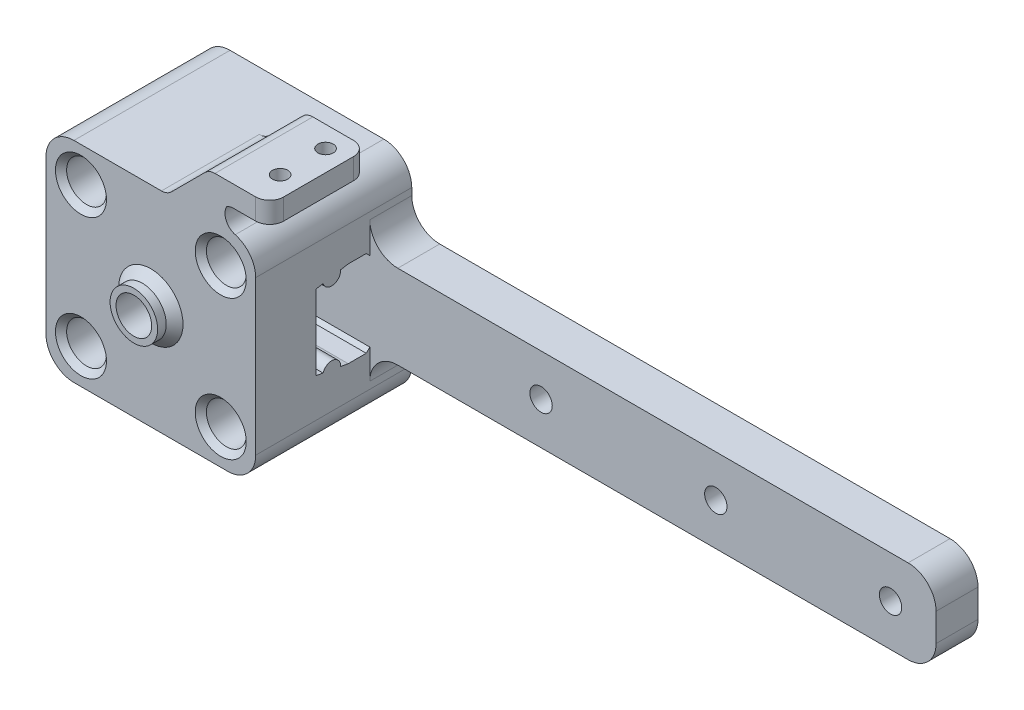
from build123d import *

# Parameters (mm, degrees)
SKETCH1_W           = 30
SKETCH1_H           = 30
SKETCH1_R           = 1.6
SKETCH1_W_2         = 81.01
SKETCH1_H_2         = 12
BOSS_EXTRUDE1_DEPTH = 6
SKETCH1_3_W         = 30
SKETCH1_3_H         = 30
SKETCH1_3_R         = 1.6
BOSS_EXTRUDE2_DEPTH = 22.33
CUT_EXTRUDE1_DEPTH  = 88.671255266
SKETCH3_R           = 2.55
CUT_EXTRUDE2_DEPTH  = 8
CUT_EXTRUDE3_DEPTH  = 4.5
SKETCH6_R           = 5
CUT_EXTRUDE5_DEPTH  = 8.6
SKETCH7_R           = 1.6
CUT_EXTRUDE6_DEPTH  = 112.183402538
SKETCH8_R           = 2.85
CUT_EXTRUDE7_DEPTH  = 18
BOSS_EXTRUDE3_START = 2.43
SKETCH9_R           = 3.4
SKETCH9_R_2         = 2.55
BOSS_EXTRUDE3_DEPTH = 2.43
CHAMFER1_SIZE       = 1.2
FILLET3_R           = 4
CHAMFER2_SIZE       = 0.8
SKETCH10_R          = 2.5
CUT_EXTRUDE8_DEPTH  = 3
CHAMFER3_SIZE       = 0.8
BOSS_EXTRUDE6_DEPTH = 14
CUT_EXTRUDE10_REACH = 116.661
SKETCH17_R          = 1.1
FILLET5_R           = 2


with BuildPart() as part:
    # Sketch1 → Boss-Extrude1 (new body)
    # profile 1 of 2: a face of its own
    with BuildSketch(Plane.XY):
        with Locations((10, 10)):
            Rectangle(SKETCH1_W, SKETCH1_H)
        with Locations((20, 0)):
            Circle(SKETCH1_R, mode=Mode.SUBTRACT)
        with Locations((20, 20)):
            Circle(SKETCH1_R, mode=Mode.SUBTRACT)
        with Locations((0, 20)):
            Circle(SKETCH1_R, mode=Mode.SUBTRACT)
        Circle(SKETCH1_R, mode=Mode.SUBTRACT)
    # profile 2 of 2: a face of its own
    with BuildSketch(Plane.XY):
        with Locations((65.505, 10)):
            Rectangle(SKETCH1_W_2, SKETCH1_H_2)
    extrude(amount=BOSS_EXTRUDE1_DEPTH)

    # Sketch1<3> → Boss-Extrude2 (add)
    with BuildSketch(Plane.XY):
        with Locations((10, 10)):
            Rectangle(SKETCH1_3_W, SKETCH1_3_H)
        with Locations((20, 0)):
            Circle(SKETCH1_3_R, mode=Mode.SUBTRACT)
        with Locations((20, 20)):
            Circle(SKETCH1_3_R, mode=Mode.SUBTRACT)
        with Locations((0, 20)):
            Circle(SKETCH1_3_R, mode=Mode.SUBTRACT)
        Circle(SKETCH1_3_R, mode=Mode.SUBTRACT)
    extrude(amount=BOSS_EXTRUDE2_DEPTH)

    # Sketch2 → Cut-Extrude1 (cut, through all)
    with BuildSketch(Plane(origin=(25, 0, 0), x_dir=(0, 0, -1), z_dir=(1, 0, 0))):
        with BuildLine():
            Line((-6.515, 16.079632043), (-9.09, 16.079632043))
            Line((-9.09, 16.079632043), (-10.173218492, 15.888631397))
            ThreePointArc((-10.173218492, 15.888631397), (-11.235427971, 14.554192061), (-12.689983513, 15.444857819))
            Line((-12.689983513, 15.444857819), (-13.725, 15.262356487))
            Line((-13.725, 15.262356487), (-13.725, 4.536907598))
            Line((-13.725, 4.536907598), (-12.689983513, 4.354406266))
            ThreePointArc((-12.689983513, 4.354406266), (-11.235427971, 5.245072025), (-10.173218492, 3.910632689))
            Line((-10.173218492, 3.910632689), (-9.09, 3.719632043))
            Line((-9.09, 3.719632043), (-6.515, 3.719632043))
            Line((-6.515, 3.719632043), (-6, 4.234632043))
            Line((-6, 4.234632043), (-6, 15.564632043))
            Line((-6, 15.564632043), (-6.515, 16.079632043))
        make_face()
    extrude(amount=-CUT_EXTRUDE1_DEPTH, mode=Mode.SUBTRACT)

    # Sketch3 → Cut-Extrude2 (cut)
    with BuildSketch(Plane.XY.offset(22.33)):
        with Locations((10, 10)):
            Circle(SKETCH3_R)
    extrude(amount=-CUT_EXTRUDE2_DEPTH, mode=Mode.SUBTRACT)

    # Sketch5 → Cut-Extrude3 (cut)
    with BuildSketch(Plane(origin=(0, 0, 13.725), x_dir=(-1, 0, 0), z_dir=(0, 0, -1))):
        Polygon((-5.32346282, 10), (-7.66173141, 14.05), (-12.33826859, 14.05), (-14.67653718, 10), (-12.33826859, 5.95), (-7.66173141, 5.95), align=None)
    extrude(amount=-CUT_EXTRUDE3_DEPTH, mode=Mode.SUBTRACT)

    # Sketch6 → Cut-Extrude5 (cut)
    with BuildSketch(Plane(origin=(0, 0, 0), x_dir=(-1, 0, 0), z_dir=(0, 0, -1))):
        with Locations((-10, 10)):
            Circle(SKETCH6_R)
    extrude(amount=-CUT_EXTRUDE5_DEPTH, mode=Mode.SUBTRACT)

    # Sketch7 → Cut-Extrude6 (cut, through all)
    with BuildSketch(Plane(origin=(0, 0, 0), x_dir=(-1, 0, 0), z_dir=(0, 0, -1))):
        with BuildLine():
            ThreePointArc((-101.1, 10), (-99.5, 8.4), (-97.9, 10))
            Line((-97.9, 10), (-101.1, 10))
        make_face()
        with BuildLine():
            Line((-101.1, 10), (-97.9, 10))
            ThreePointArc((-97.9, 10), (-99.5, 11.6), (-101.1, 10))
        make_face()
        with Locations((-74.5, 10)):
            Circle(SKETCH7_R)
        with Locations((-49.5, 10)):
            Circle(SKETCH7_R)
    extrude(amount=-CUT_EXTRUDE6_DEPTH, mode=Mode.SUBTRACT)

    # Sketch8 → Cut-Extrude7 (cut)
    with BuildSketch(Plane.XY.offset(22.33)):
        with Locations((20, 20)):
            Circle(SKETCH8_R)
        with Locations((20, 0)):
            Circle(SKETCH8_R)
        Circle(SKETCH8_R)
        with Locations((0, 20)):
            Circle(SKETCH8_R)
    extrude(amount=-CUT_EXTRUDE7_DEPTH, mode=Mode.SUBTRACT)

    # Sketch9 → Boss-Extrude3 (add)
    with BuildSketch(Plane.XY.offset(22.33).offset(BOSS_EXTRUDE3_START)):
        with Locations(Location((10, 10, 0), (0, 0, 180))):
            Circle(SKETCH9_R)
        with Locations((10, 10)):
            Circle(SKETCH9_R_2, mode=Mode.SUBTRACT)
    extrude(amount=-BOSS_EXTRUDE3_DEPTH)

    # Chamfer1
    chamfer1_edges = [part.edges().sort_by_distance(p)[0] for p in [
        (13.4, 10, 22.33),
    ]]
    chamfer(chamfer1_edges, length=CHAMFER1_SIZE)

    # Fillet3
    fillet3_edges = [part.edges().sort_by_distance(p)[0] for p in [
        (-5, -5, 11.165),
        (-5, 25, 11.165),
        (25, 25, 11.165),
        (25, 16, 3),
        (106.01, 16, 3),
        (106.01, 4, 3),
        (25, 4, 3),
        (25, -5, 11.165),
    ]]
    fillet(fillet3_edges, radius=FILLET3_R)

    # Chamfer2
    chamfer2_edges = [part.edges().sort_by_distance(p)[0] for p in [
        (-2.85, 20, 22.33),
        (-2.85, 0, 22.33),
        (17.15, 0, 22.33),
        (17.15, 20, 22.33),
    ]]
    chamfer(chamfer2_edges, length=CHAMFER2_SIZE)

    # Sketch10 → Cut-Extrude8 (cut)
    with BuildSketch(Plane(origin=(0, 0, 0), x_dir=(-1, 0, 0), z_dir=(0, 0, -1))):
        with Locations((-99.5, 10)):
            Circle(SKETCH10_R)
        with Locations((-74.5, 10)):
            Circle(SKETCH10_R)
        with Locations((-49.5, 10)):
            Circle(SKETCH10_R)
    extrude(amount=-CUT_EXTRUDE8_DEPTH, mode=Mode.SUBTRACT)

    # Chamfer3
    chamfer3_edges = [part.edges().sort_by_distance(p)[0] for p in [
        (102, 10, 0),
        (77, 10, 0),
        (52, 10, 0),
    ]]
    chamfer(chamfer3_edges, length=CHAMFER3_SIZE)

    # Sketch15 → Boss-Extrude6 (add)
    with BuildSketch(Plane.XY.offset(22.33)):
        Polygon((18.343145751, 31), (12.343145751, 25), (18, 25), (21, 28), (27, 28), (27, 31), align=None)
    extrude(amount=-BOSS_EXTRUDE6_DEPTH)

    # Sketch17 → Cut-Extrude10 (cut, up to next)
    with BuildSketch(Plane(origin=(0, 31, 0), x_dir=(1, 0, 0), z_dir=(0, 1, 0)), mode=Mode.PRIVATE) as cut_extrude10_sk1:
        with Locations(Location((24, -11.33, 0), (0, 0, 180))):
            Circle(SKETCH17_R)
    cut_extrude10_tool1 = extrude(cut_extrude10_sk1.sketch, amount=-CUT_EXTRUDE10_REACH, mode=Mode.PRIVATE) & part.part
    # Sketch17 → Cut-Extrude10 (cut, up to next)
    with BuildSketch(Plane(origin=(0, 31, 0), x_dir=(1, 0, 0), z_dir=(0, 1, 0)), mode=Mode.PRIVATE) as cut_extrude10_sk2:
        with Locations(Location((24, -17.83, 0), (0, 0, 180))):
            Circle(SKETCH17_R)
    cut_extrude10_tool2 = extrude(cut_extrude10_sk2.sketch, amount=-CUT_EXTRUDE10_REACH, mode=Mode.PRIVATE) & part.part
    add(cut_extrude10_tool1.solids().sort_by_distance((24, 31, 11.33))[0], mode=Mode.SUBTRACT)
    add(cut_extrude10_tool2.solids().sort_by_distance((24, 31, 17.83))[0], mode=Mode.SUBTRACT)

    # Fillet5
    # the kernel refuses this fillet: 2 mm, written as the material it adds along each edge
    with BuildSketch(Plane(origin=(21, 28, 22.33), x_dir=(-0.7071067811865475, -0.7071067811865475, 0), z_dir=(0, 0, -1))) as fillet5_piece_1:
        with BuildLine():
            CenterArc((FILLET5_R * 0.414213562373, -FILLET5_R), FILLET5_R, 90, 45)
            Line((-FILLET5_R * 0.292893218813, -FILLET5_R * 0.292893218813), (0, 0))
            Line((0, 0), (FILLET5_R * 0.414213562373, 0))
        make_face()
    extrude(amount=14)
    with BuildSketch(Plane(origin=(12.343145751, 25, 22.33), x_dir=(-1, 0, 0), z_dir=(0, 0, -1))) as fillet5_piece_2:
        with BuildLine():
            CenterArc((FILLET5_R * 0.414213562373, FILLET5_R), FILLET5_R, 225, 45)
            Line((-FILLET5_R * 0.292893218813, FILLET5_R * 0.292893218813), (0, 0))
            Line((0, 0), (FILLET5_R * 0.414213562373, 0))
        make_face()
    extrude(amount=14)
    with BuildSketch(Plane(origin=(18, 25, 22.33), x_dir=(0.9993539414176275, -0.03594022500003582, 0), z_dir=(0, 0, -1))) as fillet5_piece_3:
        with BuildLine():
            CenterArc((4.541773641, -1.944797545), FILLET5_R, 103.492916805, 119.447416414)
            Line((3.07764659, -3.307270289), (2.931233885, -3.443517564))
            Line((2.931233885, -3.443517564), (-0.146412705, -0.136247274))
            Line((-0.146412705, -0.136247274), (0.007188045, 0.199870788))
            ThreePointArc((0.007188045, 0.199870788), (3.005249869, 0.092050113), (4.028458305, 0.194479755))
            Line((4.028458305, 0.194479755), (4.075123335, 0))
        make_face()
    extrude(amount=14)
    # the kernel refuses this fillet: 2 mm, written as the material it takes off along each edge
    with BuildSketch(Plane(origin=(27, 23, 22.33), x_dir=(-1, 0, 0), z_dir=(0, 1, 0))) as fillet5_2_piece_1:
        with BuildLine():
            CenterArc((FILLET5_R, -FILLET5_R), FILLET5_R, 90, 90)
            Line((0, -FILLET5_R), (0, 0))
            Line((0, 0), (FILLET5_R, 0))
        make_face()
    extrude(amount=13, mode=Mode.SUBTRACT)
    with BuildSketch(Plane(origin=(27, 23, 8.33), x_dir=(-1, 0, 0), z_dir=(0, 1, 0))) as fillet5_2_piece_2:
        with BuildLine():
            CenterArc((FILLET5_R, FILLET5_R), FILLET5_R, 180, 90)
            Line((0, FILLET5_R), (0, 0))
            Line((0, 0), (FILLET5_R, 0))
        make_face()
    extrude(amount=13, mode=Mode.SUBTRACT)
    with BuildSketch(Plane(origin=(18.343145751, 31, 24.401067812), x_dir=(-0.7071067811865476, -0.7071067811865476, 0), z_dir=(0, 0, -1))) as fillet5_2_piece_3:
        with BuildLine():
            CenterArc((FILLET5_R * 0.414213562373, -FILLET5_R), FILLET5_R, 90, 45)
            Line((-FILLET5_R * 0.292893218813, -FILLET5_R * 0.292893218813), (0, 0))
            Line((0, 0), (FILLET5_R * 0.414213562373, 0))
        make_face()
    extrude(amount=18.142135624, mode=Mode.SUBTRACT)


solid = part.part
